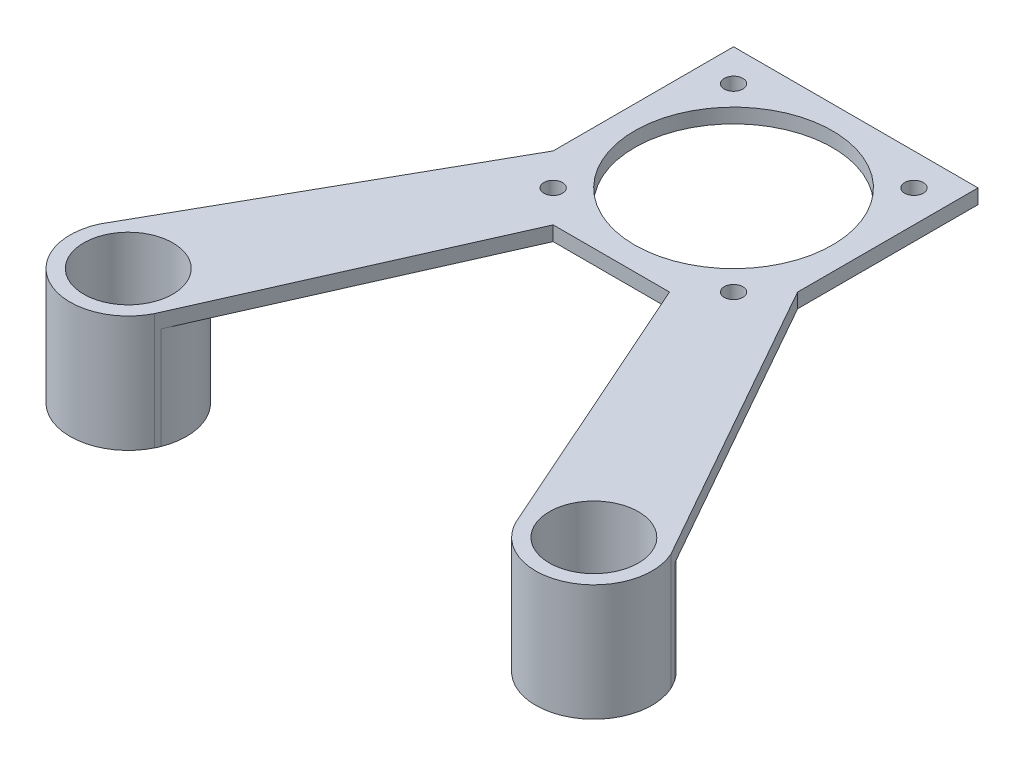
from build123d import *

# Parameters (mm, degrees)
SKETCH_6_W      = 42
SKETCH_6_H      = 42
SKETCH_6_R      = 1.6
SKETCH_6_R_2    = 17
EXTRUDE_1_DEPTH = 2.5
SKETCH_7_R      = 7.65
EXTRUDE_5_DEPTH = 2.5
SKETCH_7_7_R    = 7.65
EXTRUDE_7_DEPTH = 20
SKETCH_7_8_R    = 7.65
EXTRUDE_8_DEPTH = 20


with BuildPart() as part:
    # 草图6 → 凸台-拉伸1 (new body)
    with BuildSketch(Plane(origin=(0, 0, 0), x_dir=(1, 0, 0), z_dir=(0, 1, 0))):
        Rectangle(SKETCH_6_W, SKETCH_6_H)
        with Locations((15.5, 15.5)):
            Circle(SKETCH_6_R, mode=Mode.SUBTRACT)
        with Locations((-15.5, 15.5)):
            Circle(SKETCH_6_R, mode=Mode.SUBTRACT)
        with Locations((-15.5, -15.5)):
            Circle(SKETCH_6_R, mode=Mode.SUBTRACT)
        with Locations((15.5, -15.5)):
            Circle(SKETCH_6_R, mode=Mode.SUBTRACT)
        Circle(SKETCH_6_R_2, mode=Mode.SUBTRACT)
    extrude(amount=EXTRUDE_1_DEPTH)

    # 草图7 → 凸台-拉伸5 (add)
    # profile 1 of 2: a face of its own
    with BuildSketch(Plane(origin=(0, 2.5, 0), x_dir=(1, 0, 0), z_dir=(0, 1, 0))):
        with BuildLine():
            Line((-10, -21), (-21, -21))
            Line((-21, -21), (-21, -10))
            Line((-21, -10), (-49.089190248, -59.830273313))
            ThreePointArc((-49.089190248, -59.830273313), (-44.301050518, -73.027788458), (-31.035510623, -68.431470434))
            Line((-31.035510623, -68.431470434), (-10, -21))
        make_face()
        with Locations((-40, -64)):
            Circle(SKETCH_7_R, mode=Mode.SUBTRACT)
    # profile 2 of 2: a face of its own
    with BuildSketch(Plane(origin=(0, 2.5, 0), x_dir=(1, 0, 0), z_dir=(0, 1, 0))):
        with BuildLine():
            Line((21, -10), (21, -21))
            Line((21, -21), (10, -21))
            Line((10, -21), (31.035510623, -68.431470434))
            ThreePointArc((31.035510623, -68.431470434), (44.301050518, -73.027788458), (49.089190248, -59.830273313))
            Line((49.089190248, -59.830273313), (21, -10))
        make_face()
        with Locations((40, -64)):
            Circle(SKETCH_7_R, mode=Mode.SUBTRACT)
    extrude(amount=-EXTRUDE_5_DEPTH)

    # 草图7<7> → 凸台-拉伸7 (add)
    with BuildSketch(Plane(origin=(0, 2.5, 0), x_dir=(1, 0, 0), z_dir=(0, 1, 0))):
        with BuildLine():
            Line((49.089190248, -59.830273313), (48.273152565, -58.382621018))
            ThreePointArc((48.273152565, -58.382621018), (35.328022799, -55.158471341), (30.697682143, -67.669725124))
            Line((30.697682143, -67.669725124), (31.035510623, -68.431470434))
            ThreePointArc((31.035510623, -68.431470434), (42.275423722, -73.737681802), (50, -64))
            ThreePointArc((50, -64), (49.769644376, -61.865978266), (49.089190248, -59.830273313))
        make_face()
        with Locations((40, -64)):
            Circle(SKETCH_7_7_R, mode=Mode.SUBTRACT)
    extrude(amount=-EXTRUDE_7_DEPTH)

    # 草图7<8> → 凸台-拉伸8 (add)
    with BuildSketch(Plane(origin=(0, 2.5, 0), x_dir=(1, 0, 0), z_dir=(0, 1, 0))):
        with BuildLine():
            Line((-31.035510623, -68.431470434), (-30.697682143, -67.669725124))
            ThreePointArc((-30.697682143, -67.669725124), (-30.175968786, -65.867728759), (-30, -64))
            ThreePointArc((-30, -64), (-37.061592749, -54.44145603), (-48.273152565, -58.382621018))
            Line((-48.273152565, -58.382621018), (-49.089190248, -59.830273313))
            ThreePointArc((-49.089190248, -59.830273313), (-44.301050518, -73.027788458), (-31.035510623, -68.431470434))
        make_face()
        with Locations((-40, -64)):
            Circle(SKETCH_7_8_R, mode=Mode.SUBTRACT)
    extrude(amount=-EXTRUDE_8_DEPTH)


solid = part.part
